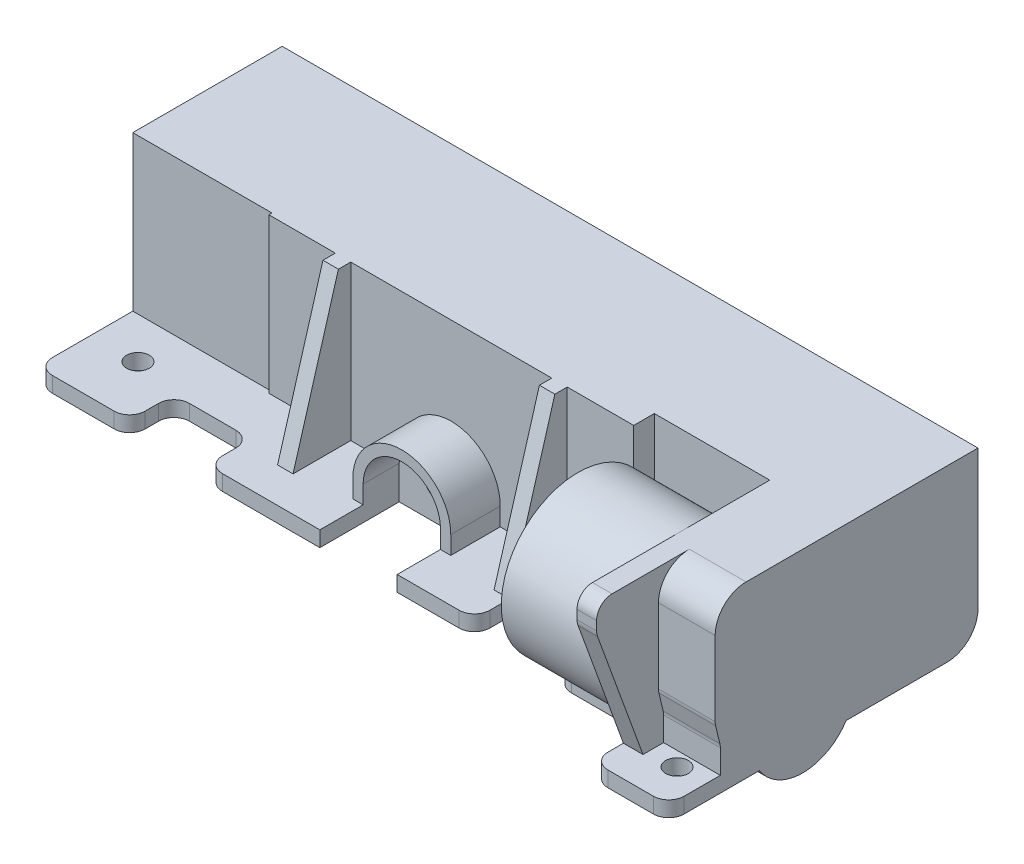
from build123d import *

# Parameters (mm, degrees)
EXTRUDE_1_DEPTH          = 1.5
EXTRUDE_2_DEPTH          = 16.5
EXTRUDE_START            = 36.3
EXTRUDE_3_DEPTH          = 6.2
EXTRUDE_START_2          = 28.9
EXTRUDE_4_DEPTH          = 1.9
CUT_EXTRUDE_START        = 36.3
CUT_EXTRUDE_1_DEPTH      = 5.5
SKETCH_3_6_R             = 7.45
EXTRUDE_7_DEPTH          = 10
FILLET_1_R               = 1.5
FILLET_2_R               = 1.5
FILLET_3_R               = 1.5
FILLET_4_R               = 3
EXTRUDE_START_3          = -4.7
EXTRUDE_5_DEPTH          = 4.8
CUT_EXTRUDE_START_2      = -3.4
CUT_EXTRUDE_2_OUTLINE_W  = 7.5
CUT_EXTRUDE_2_OUTLINE_H  = 1.5
CUT_EXTRUDE_2_DEPTH      = 0.5
EXTRUDE_6_DEPTH          = 1.3
CUT_EXTRUDE_START_3      = -19.5
CUT_EXTRUDE_3_DEPTH      = 13
CUT_EXTRUDE_4_DEPTH      = 44.001744151
CUT_EXTRUDE_4_DEPTH_BACK = 44.001744151
SKETCH_5_R               = 1.25
EXTRUDE_START_4          = 9.75
EXTRUDE_8_DEPTH          = 1.5
EXTRUDE_START_5          = -9.75
EXTRUDE_9_DEPTH          = 1.5
SKETCH_7_W               = 29
SKETCH_7_H               = 7
CUT_EXTRUDE_5_DEPTH      = 9
SKETCH_7_3_W             = 29
SKETCH_7_3_H             = 8
CUT_EXTRUDE_6_DEPTH      = 1
FILLET_5_R               = 3
FILLET_6_R               = 3
SKETCH_1_4_R             = 1.1
CUT_EXTRUDE_7_DEPTH      = 2


# Read off the part's stored shape, not the designer's step: Бобышка-Вытянуть5, Вырез-Вытянуть2, Бобышка-Вытянуть6, Вырез-Вытянуть3
with BuildPart() as part:
    # Эскиз1 → Бобышка-Вытянуть1 (new body)
    with BuildSketch(Plane(origin=(0, 0, 0), x_dir=(1, 0, 0), z_dir=(0, 1, 0))):
        Polygon((36.3, 19.5), (-31.2, 19.5), (-31.2, -4.3), (-22.2, -4.3), (-22.2, 0), (-14.7, 0), (-14.7, -4.3), (-3.75, -4.3), (-3.75, 2.9), (3.75, 2.9), (3.75, -4.3), (11.25, -4.3), (11.25, 0), (19.15, 0), (19.15, -4.3), (28.9, -4.3), (28.9, -10.5), (36.3, -10.5), align=None)
    extrude(amount=EXTRUDE_1_DEPTH)

    # Эскиз1<3> → Бобышка-Вытянуть2 (add)
    with BuildSketch(Plane(origin=(0, 0, 0), x_dir=(1, 0, 0), z_dir=(0, 1, 0))):
        Polygon((36.3, 19.5), (-31.2, 19.5), (-31.2, 5), (-17.7, 5), (-17.7, 4.7), (17.7, 4.7), (17.7, 6.7), (28.9, 6.7), (28.9, -6), (36.3, -6), align=None)
    extrude(amount=EXTRUDE_2_DEPTH)

    # Эскиз3 → Бобышка-Вытянуть3 (add)
    with BuildSketch(Plane(origin=(0, 0, 0), x_dir=(0, 0, -1), z_dir=(1, 0, 0)).offset(EXTRUDE_START)):
        with BuildLine():
            Line((0, 1.5), (0, 0))
            Line((0, 0), (6.708325083, 0))
            ThreePointArc((6.708325083, 0), (7.092746426, 0.723467616), (7.35386444, 1.5))
            Line((7.35386444, 1.5), (0, 1.5))
        make_face()
        with BuildLine():
            Line((6.708325083, 0), (0, 0))
            Line((0, 0), (0, 1.5))
            Line((0, 1.5), (-2.35386444, 1.5))
            ThreePointArc((-2.35386444, 1.5), (1.683495092, -2.232881484), (6.708325083, 0))
        make_face()
    extrude(amount=-EXTRUDE_3_DEPTH)

    # Эскиз3<4> → Бобышка-Вытянуть4 (add)
    with BuildSketch(Plane(origin=(0, 0, 0), x_dir=(0, 0, -1), z_dir=(1, 0, 0)).offset(EXTRUDE_START_2)):
        Polygon((-7.5, 1.5), (-6, 1.5), (-6, 16.5), (-12, 16.5), (-12, 13.863648388), align=None)
    extrude(amount=EXTRUDE_4_DEPTH)

    # Эскиз3<5> → Вырез-Вытянуть1 (cut)
    with BuildSketch(Plane(origin=(0, 0, 0), x_dir=(0, 0, -1), z_dir=(1, 0, 0)).offset(CUT_EXTRUDE_START)):
        Polygon((-6, 1.5), (-5.5, 1.5), (-5.5, 4), (-6, 6.078204319), align=None)
    extrude(amount=-CUT_EXTRUDE_1_DEPTH, mode=Mode.SUBTRACT)

    # Эскиз3<6> → Бобышка-Вытянуть7 (add)
    with BuildSketch(Plane(origin=(0, 0, 0), x_dir=(0, 0, -1), z_dir=(1, 0, 0)).offset(EXTRUDE_START_2)):
        with Locations((-1.9, 9)):
            Circle(SKETCH_3_6_R)
    extrude(amount=-EXTRUDE_7_DEPTH)

    # Скругление1
    fillet_1_edges = [part.edges().sort_by_distance(p)[0] for p in [
        (36.3, 0.75, 10.5),
        (28.9, 0.75, 10.5),
        (19.15, 0.75, 4.3),
        (19.15, 0.75, 0),
        (11.25, 0.75, 0),
        (11.25, 0.75, 4.3),
        (-14.7, 0.75, 4.3),
        (-14.7, 0.75, 0),
        (-22.2, 0.75, 0),
        (-22.2, 0.75, 4.3),
        (-31.2, 0.75, 4.3),
    ]]
    fillet(fillet_1_edges, radius=FILLET_1_R)

    # Скругление2
    fillet_2_edges = [part.edges().sort_by_distance(p)[0] for p in [
        (29.85, 16.5, 12),
        (29.85, 13.863648388, 12),
    ]]
    fillet(fillet_2_edges, radius=FILLET_2_R)

    # Скругление3
    fillet_3_edges = [part.edges().sort_by_distance(p)[0] for p in [
        (33.55, 6.078204319, 6),
        (33.55, 4, 5.5),
    ]]
    fillet(fillet_3_edges, radius=FILLET_3_R)

    # Скругление4
    fillet_4_edges = [part.edges().sort_by_distance(p)[0] for p in [
        (33.55, 16.5, 6),
    ]]
    fillet(fillet_4_edges, radius=FILLET_4_R)

    # Бобышка-Вытянуть5 outline → Бобышка-Вытянуть5 (add)
    with BuildSketch(Plane.XY.offset(EXTRUDE_START_3)):
        with BuildLine():
            Line((-3.75, 1.5), (-3.75, 3.25))
            ThreePointArc((-3.75, 3.25), (0, 7), (3.75, 3.25))
            Line((3.75, 3.25), (3.75, 1.5))
            Line((3.75, 1.5), (4.75, 1.5))
            Line((4.75, 1.5), (4.75, 3.25))
            ThreePointArc((4.75, 3.25), (0, 8), (-4.75, 3.25))
            Line((-4.75, 3.25), (-4.75, 1.5))
            Line((-4.75, 1.5), (-3.75, 1.5))
        make_face()
    extrude(amount=EXTRUDE_5_DEPTH)

    # Вырез-Вытянуть2 outline → Вырез-Вытянуть2 (cut)
    with BuildSketch(Plane.XY.offset(CUT_EXTRUDE_START_2)):
        with Locations((0, 0.75)):
            Rectangle(CUT_EXTRUDE_2_OUTLINE_W, CUT_EXTRUDE_2_OUTLINE_H)
    extrude(amount=CUT_EXTRUDE_2_DEPTH, mode=Mode.SUBTRACT)

    # Бобышка-Вытянуть6 outline → Бобышка-Вытянуть6 (add)
    with BuildSketch(Plane.XY.offset(EXTRUDE_START_3)):
        with BuildLine():
            Line((-3.75, 1.5), (3.75, 1.5))
            Line((3.75, 1.5), (3.75, 3.25))
            ThreePointArc((3.75, 3.25), (0, 7), (-3.75, 3.25))
            Line((-3.75, 3.25), (-3.75, 1.5))
        make_face()
    extrude(amount=EXTRUDE_6_DEPTH)

    # Вырез-Вытянуть3 outline → Вырез-Вытянуть3 (cut)
    with BuildSketch(Plane.XY.offset(CUT_EXTRUDE_START_3)):
        with BuildLine():
            Line((-3.75, 3.25), (-3.75, 0))
            Line((-3.75, 0), (3.75, 0))
            Line((3.75, 0), (3.75, 3.25))
            ThreePointArc((3.75, 3.25), (0, 7), (-3.75, 3.25))
        make_face()
    extrude(amount=CUT_EXTRUDE_3_DEPTH, mode=Mode.SUBTRACT)

    # Эскиз5 → Вырез-Вытянуть4 (cut, two sides: drawn at the far end of the back side and taken through both)
    with BuildSketch(Plane.XY.offset(-3.4).offset(-CUT_EXTRUDE_4_DEPTH_BACK)):
        with Locations((0, 3.25)):
            Circle(SKETCH_5_R)
    extrude(amount=CUT_EXTRUDE_4_DEPTH + CUT_EXTRUDE_4_DEPTH_BACK, mode=Mode.SUBTRACT)

    # Эскиз6 → Бобышка-Вытянуть8 (add)
    with BuildSketch(Plane(origin=(0, 0, 0), x_dir=(0, 0, -1), z_dir=(1, 0, 0)).offset(EXTRUDE_START_4)):
        Polygon((4.7, 1.5), (4.7, 16.5), (3.5, 16.5), (-0.9, 1.5), align=None)
    extrude(amount=EXTRUDE_8_DEPTH)

    # Эскиз6<4> → Бобышка-Вытянуть9 (add)
    with BuildSketch(Plane(origin=(0, 0, 0), x_dir=(0, 0, -1), z_dir=(1, 0, 0)).offset(EXTRUDE_START_5)):
        Polygon((4.7, 1.5), (4.7, 16.5), (3.5, 16.5), (-0.9, 1.5), align=None)
    extrude(amount=-EXTRUDE_9_DEPTH)

    # Эскиз7 → Вырез-Вытянуть5 (cut)
    with BuildSketch(Plane(origin=(0, 0, 0), x_dir=(1, 0, 0), z_dir=(0, 1, 0))):
        with Locations((14.5, 16)):
            Rectangle(SKETCH_7_W, SKETCH_7_H)
        with Locations((-14.5, 16)):
            Rectangle(SKETCH_7_W, SKETCH_7_H)
    extrude(amount=CUT_EXTRUDE_5_DEPTH, mode=Mode.SUBTRACT)

    # Эскиз7<3> → Вырез-Вытянуть6 (cut)
    with BuildSketch(Plane(origin=(0, 0, 0), x_dir=(1, 0, 0), z_dir=(0, 1, 0))):
        with Locations((14.5, 8.5)):
            Rectangle(SKETCH_7_3_W, SKETCH_7_3_H)
        with Locations((-14.5, 8.5)):
            Rectangle(SKETCH_7_3_W, SKETCH_7_3_H)
    extrude(amount=CUT_EXTRUDE_6_DEPTH, mode=Mode.SUBTRACT)

    # Скругление5
    fillet_5_edges = [part.edges().sort_by_distance(p)[0] for p in [
        (-16.375, 1, -12.5),
        (16.375, 1, -12.5),
    ]]
    fillet(fillet_5_edges, radius=FILLET_5_R)

    # Скругление6
    fillet_6_edges = [part.edges().sort_by_distance(p)[0] for p in [
        (-30.1, 0, -19.5),
        (32.65, 0, -19.5),
    ]]
    fillet(fillet_6_edges, radius=FILLET_6_R)

    # Эскиз1<4> → Вырез-Вытянуть7 (cut)
    with BuildSketch(Plane(origin=(0, 0, 0), x_dir=(1, 0, 0), z_dir=(0, 1, 0))):
        with Locations(Location((-26.7, 1, 0), (0, 0, 270))):
            Circle(SKETCH_1_4_R)
        with Locations(Location((33.5, -6.9, 0), (0, 0, 270))):
            Circle(SKETCH_1_4_R)
    extrude(amount=CUT_EXTRUDE_7_DEPTH, mode=Mode.SUBTRACT)


solid = part.part
